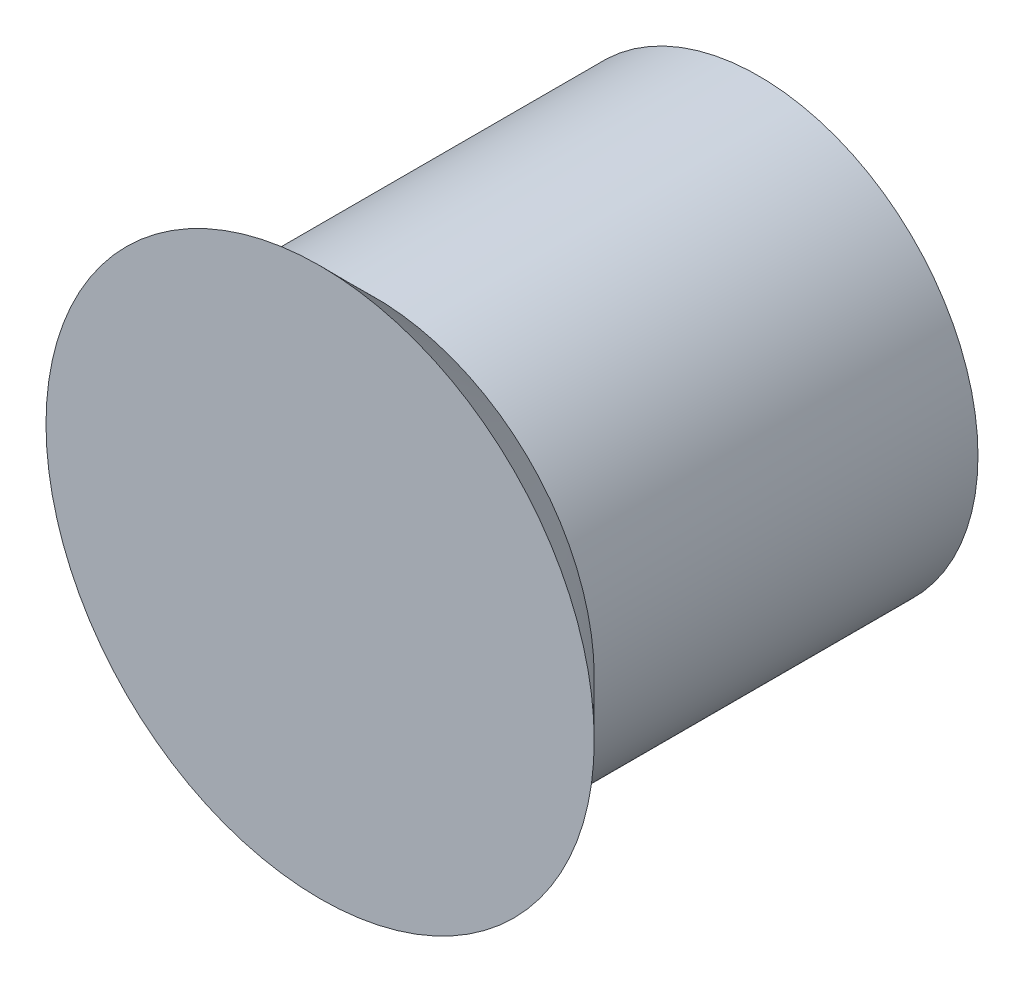
from build123d import *

# Parameters (mm, degrees)
IZIM1_R                     = 4
Y_KSEKLIK_EKSTR_ZYON1_DEPTH = 7
IZIM2_R                     = 4
Y_KSEKLIK_EKSTR_ZYON2_DEPTH = 1
Y_KSEKLIK_EKSTR_ZYON2_DRAFT = -45


with BuildPart() as part:
    # Çizim1 → Yükseklik-Ekstrüzyon1 (new body)
    with BuildSketch(Plane.XY):
        Circle(IZIM1_R)
    extrude(amount=Y_KSEKLIK_EKSTR_ZYON1_DEPTH)


with BuildPart() as y_kseklik_ekstr_zyon2_tool:
    # Çizim2 → Yükseklik-Ekstrüzyon2 (with draft: the straight prism first)
    with BuildSketch(Plane.XY.offset(7)):
        Circle(IZIM2_R)
    extrude(amount=Y_KSEKLIK_EKSTR_ZYON2_DEPTH)
    # Yükseklik-Ekstrüzyon2: the draft: its side faces are tilted about the plane it starts from
    y_kseklik_ekstr_zyon2_sides = [y_kseklik_ekstr_zyon2_tool.faces().sort_by_distance(p)[0] for p in [
        (-4, 0, 7.5),
    ]]
    draft(y_kseklik_ekstr_zyon2_sides, Plane.XY.offset(7), Y_KSEKLIK_EKSTR_ZYON2_DRAFT)


with BuildPart() as part_1:
    add(part.part)

    # Yükseklik-Ekstrüzyon2: add y_kseklik_ekstr_zyon2_tool
    add(y_kseklik_ekstr_zyon2_tool.part)


solid = part_1.part
